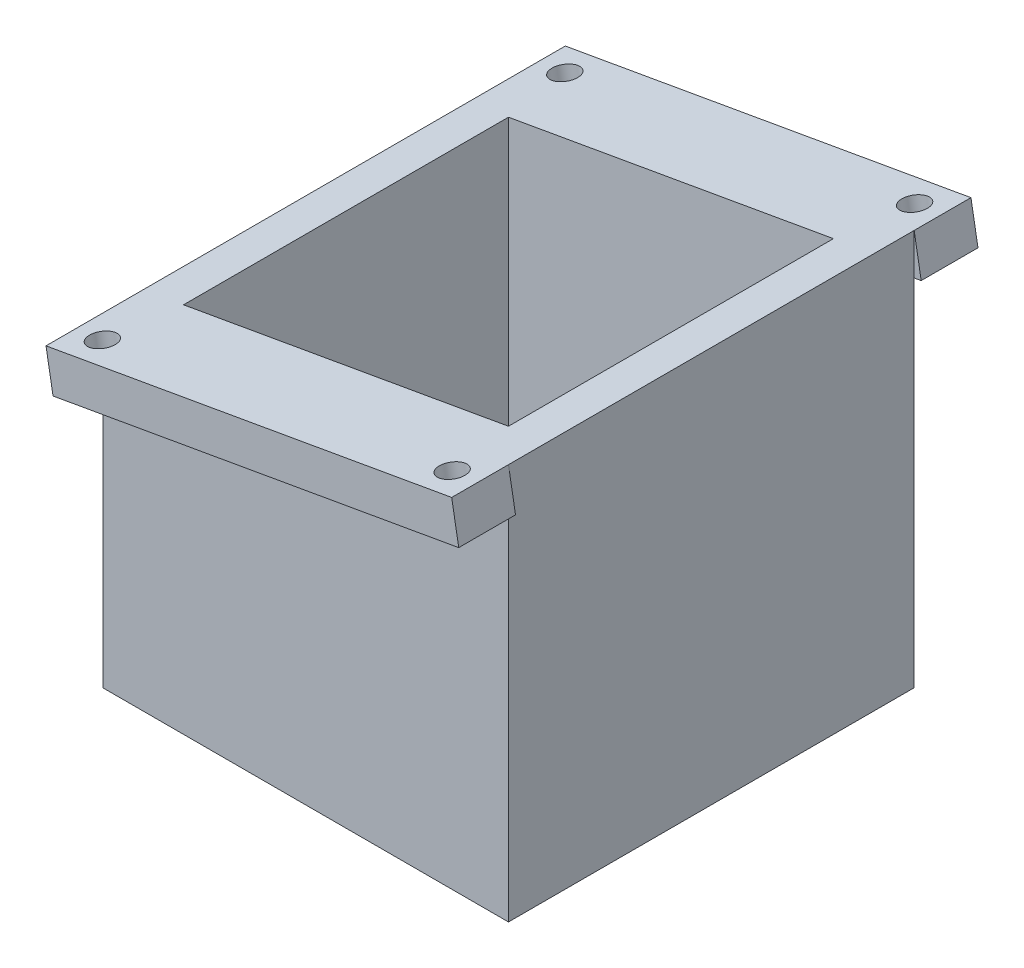
from build123d import *

# Parameters (mm, degrees)
SKETCH2_W             = 50
SKETCH2_H             = 50
SKETCH2_W_2           = 36.05
SKETCH2_H_2           = 36.05
BOSS_EXTRUDE2_DEPTH   = 5
SKETCH1_W             = 50
SKETCH1_H             = 50
SKETCH1_W_2           = 40.05
SKETCH1_H_2           = 40.05
BOSS_EXTRUDE4_DEPTH   = 40
BOSS_EXTRUDE5_START   = -25
BOSS_EXTRUDE5_DEPTH   = 50
BOSS_EXTRUDE5_2_DEPTH = 4.975
BOSS_EXTRUDE5_START_2 = 20.025
BOSS_EXTRUDE5_3_DEPTH = 4.975
SKETCH7_W             = 50.771330761
SKETCH7_H             = 7
BOSS_EXTRUDE6_DEPTH   = 5
SKETCH8_R             = 1.6
CUT_EXTRUDE1_DEPTH    = 5


# Read off the part's stored shape, not the designer's step: Boss-Extrude5
with BuildPart() as part:
    # Sketch2 → Boss-Extrude2 (new body)
    with BuildSketch(Plane(origin=(0, 0, 0), x_dir=(1, 0, 0), z_dir=(0, 1, 0))):
        Rectangle(SKETCH2_W, SKETCH2_H)
        Rectangle(SKETCH2_W_2, SKETCH2_H_2, mode=Mode.SUBTRACT)
    extrude(amount=BOSS_EXTRUDE2_DEPTH)

    # Sketch1 → Boss-Extrude4 (add)
    with BuildSketch(Plane(origin=(0, 0, 0), x_dir=(1, 0, 0), z_dir=(0, 1, 0))):
        Rectangle(SKETCH1_W, SKETCH1_H)
        Rectangle(SKETCH1_W_2, SKETCH1_H_2, mode=Mode.SUBTRACT)
    extrude(amount=BOSS_EXTRUDE4_DEPTH)

    # Boss-Extrude5 outline → Boss-Extrude5 (add)
    with BuildSketch(Plane.XY.offset(BOSS_EXTRUDE5_START)):
        Polygon((25, 40), (25, 48.81635), (20.025, 47.939123175), (20.025, 40), align=None)
        Polygon((-20.025, 40), (-20.025, 40.877226825), (-25, 40), align=None)
    extrude(amount=BOSS_EXTRUDE5_DEPTH)

    # Boss-Extrude5 2 outline → Boss-Extrude5 2 (add)
    with BuildSketch(Plane.XY.offset(BOSS_EXTRUDE5_START)):
        Polygon((20.025, 40), (20.025, 47.939123175), (-20.025, 40.877226825), (-20.025, 40), align=None)
    extrude(amount=BOSS_EXTRUDE5_2_DEPTH)

    # Boss-Extrude5 3 outline → Boss-Extrude5 3 (add)
    with BuildSketch(Plane.XY.offset(BOSS_EXTRUDE5_START_2)):
        Polygon((20.025, 40), (20.025, 47.939123175), (-20.025, 40.877226825), (-20.025, 40), align=None)
    extrude(amount=BOSS_EXTRUDE5_3_DEPTH)

    # Sketch7 → Boss-Extrude6 (add)
    with BuildSketch(Plane(origin=(-7.59424597, 43.069104391, 0), x_dir=(0.984807749763281, 0.17364819609251012, 0), z_dir=(-0.17364819609251012, 0.984807749763281, 0))):
        with Locations((7.71139948, 28.5)):
            Rectangle(SKETCH7_W, SKETCH7_H)
        with Locations((7.71139948, -28.5)):
            Rectangle(SKETCH7_W, SKETCH7_H)
    extrude(amount=-BOSS_EXTRUDE6_DEPTH)

    # Sketch8 → Cut-Extrude1 (cut)
    with BuildSketch(Plane(origin=(-7.59424597, 43.069104391, 0), x_dir=(0.984807749763281, 0.17364819609251012, 0), z_dir=(-0.17364819609251012, 0.984807749763281, 0))):
        with Locations(Location((-14.1742659, -28.5, 0), (0, 0, 180))):
            Circle(SKETCH8_R)
        with Locations((29.597064861, -28.5)):
            Circle(SKETCH8_R)
        with Locations(Location((29.597064861, 28.5, 0), (0, 0, 180))):
            Circle(SKETCH8_R)
        with Locations((-14.1742659, 28.5)):
            Circle(SKETCH8_R)
    extrude(amount=-CUT_EXTRUDE1_DEPTH, mode=Mode.SUBTRACT)


solid = part.part
